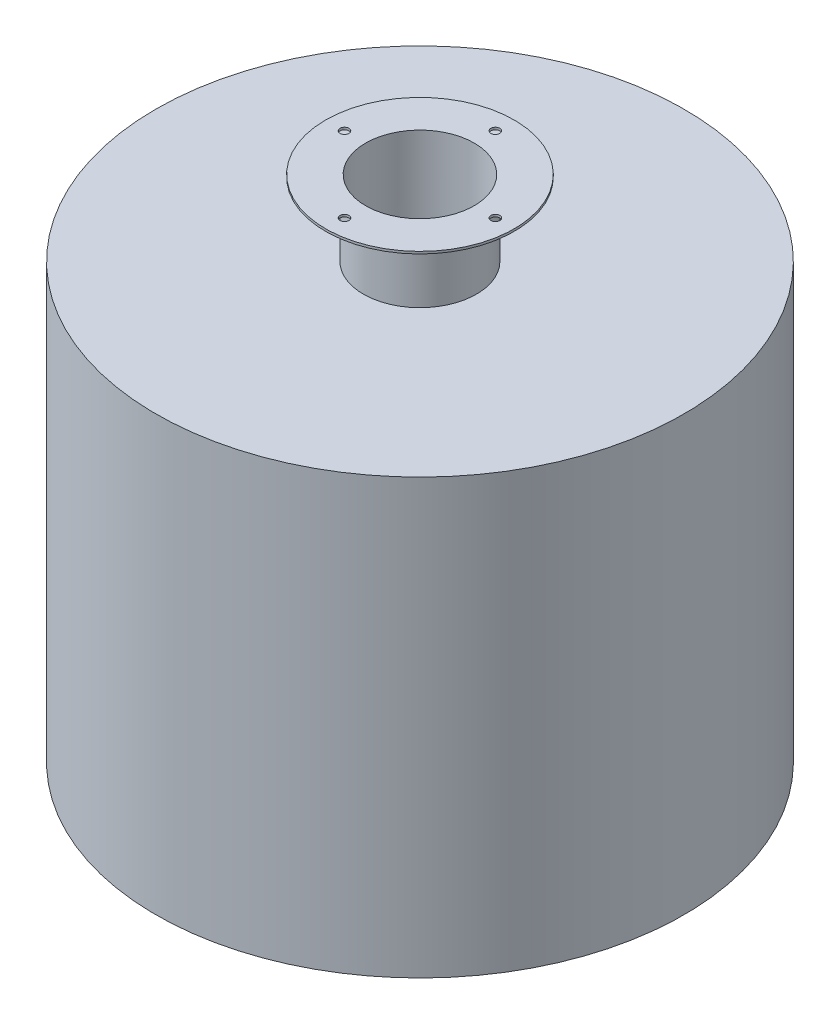
from build123d import *

# Parameters (mm, degrees)
SHELL2_START       = 1.524
SHELL2_OUTLINE_R   = 176.276
SHELL2_DEPTH       = 289.052
SHELL2_START_2     = 290.576
SHELL2_2_OUTLINE_R = 36.576
SHELL2_2_DEPTH     = 52.324
CUT_EXTRUDE1_REACH = 427.213
SKETCH2_R          = 2.999994
CIRPATTERN1_COUNT  = 4


# Read off the part's stored shape, not the designer's step: Shell2
with BuildPart() as part:
    # Sketch1 → Revolve1 (revolve)
    with BuildSketch(Plane.XY, mode=Mode.PRIVATE) as revolve1_sk:
        Polygon((0, 0), (177.8, 0), (177.8, 292.1), (38.1, 292.1), (38.1, 341.376), (63.5, 341.376), (63.5, 342.9), (0, 342.9), align=None)
    revolve(revolve1_sk.sketch.rotate(Axis((0, 342.9, 0), (0, -1, 0)), 180), axis=Axis((0, 342.9, 0), (0, -1, 0)))

    # Shell2 outline → Shell2 (cut)
    with BuildSketch(Plane(origin=(0, 0, 0), x_dir=(1, 0, 0), z_dir=(0, 1, 0)).offset(SHELL2_START)):
        Circle(SHELL2_OUTLINE_R)
    extrude(amount=SHELL2_DEPTH, mode=Mode.SUBTRACT)

    # Shell2 2 outline → Shell2 2 (cut)
    with BuildSketch(Plane(origin=(0, 0, 0), x_dir=(1, 0, 0), z_dir=(0, 1, 0)).offset(SHELL2_START_2)):
        Circle(SHELL2_2_OUTLINE_R)
    extrude(amount=SHELL2_2_DEPTH, mode=Mode.SUBTRACT)

    # Sketch2 → Cut-Extrude1 (cut, up to next)
    with BuildSketch(Plane(origin=(0, 342.9, 0), x_dir=(1, 0, 0), z_dir=(0, 1, 0)), mode=Mode.PRIVATE) as cut_extrude1_sk1:
        with Locations(Location((50.8, 0, 0), (0, 0, 180))):
            Circle(SKETCH2_R)
    cut_extrude1_tool1 = extrude(cut_extrude1_sk1.sketch, amount=-CUT_EXTRUDE1_REACH, mode=Mode.PRIVATE) & part.part
    cut_extrude1 = cut_extrude1_tool1.solids().sort_by_distance((50.8, 342.9, 0))[0]
    add(cut_extrude1, mode=Mode.SUBTRACT)

    # CirPattern1: Cut-Extrude1 ×4 about axis
    cirpattern1_axis = Axis((0, 0, 0), (0, 1, 0))
    for i in range(1, CIRPATTERN1_COUNT):
        add(cut_extrude1.rotate(cirpattern1_axis, i * 360 / CIRPATTERN1_COUNT), mode=Mode.SUBTRACT)


solid = part.part
